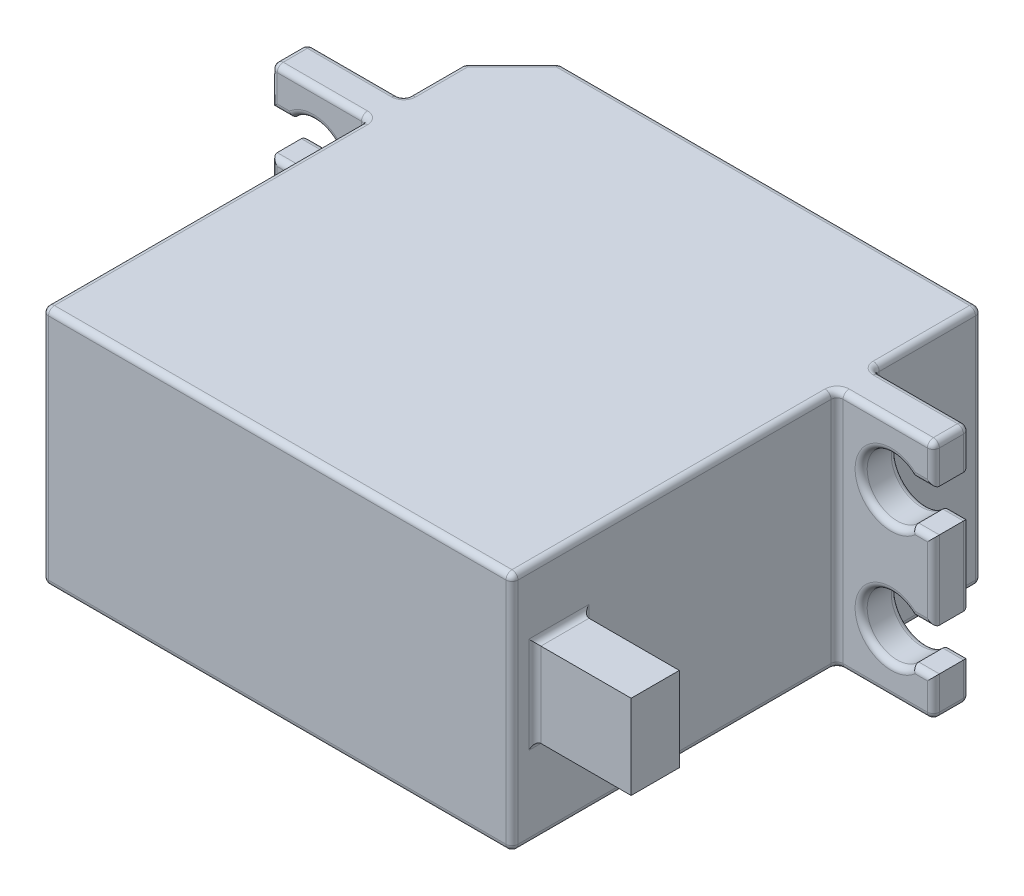
from build123d import *

# Parameters (mm, degrees)
BOSS_EXTRU_1_DEPTH      = 20
BOSS_EXTRU_2_DEPTH      = 8
BOSS_EXTRU_2_DEPTH_BACK = 47
ESQUISSE2_W             = 3
ESQUISSE2_H             = 20
ENL_V_MAT_EXTRU_1_DEPTH = 8
ENL_V_MAT_EXTRU_2_DEPTH = 8
ESQUISSE6_R             = 6
BOSS_EXTRU_3_DEPTH      = 1
ESQUISSE7_R             = 3
BOSS_EXTRU_4_DEPTH      = 4
ESQUISSE8_W             = 4
ESQUISSE8_H             = 7
BOSS_EXTRU_5_DEPTH      = 8
CONG_1_R                = 0.5


with BuildPart() as part:
    # Esquisse1 → Boss.-Extru.1 (new body)
    with BuildSketch(Plane(origin=(0, 0, 0), x_dir=(1, 0, 0), z_dir=(0, 1, 0))):
        Polygon((0, 35), (4, 39), (39, 39), (39, 0), (0, 0), align=None)
    extrude(amount=BOSS_EXTRU_1_DEPTH)

    # Esquisse2 → Boss.-Extru.2 (add, two sides: drawn at the far end of the back side and taken through both)
    with BuildSketch(Plane.ZY.offset(-BOSS_EXTRU_2_DEPTH_BACK)):
        with Locations((-28.5, 10)):
            Rectangle(ESQUISSE2_W, ESQUISSE2_H)
    extrude(amount=BOSS_EXTRU_2_DEPTH + BOSS_EXTRU_2_DEPTH_BACK)

    # Esquisse3 → Enlèv. mat.-Extru.1 (cut)
    with BuildSketch(Plane(origin=(0, 0, -30), x_dir=(-1, 0, 0), z_dir=(0, 0, -1))):
        with BuildLine():
            Line((6.285357107, 3.25), (8, 3.25))
            Line((8, 3.25), (8, 6.75))
            Line((8, 6.75), (6.285357107, 6.75))
            ThreePointArc((6.285357107, 6.75), (2, 5), (6.285357107, 3.25))
        make_face()
        with BuildLine():
            Line((6.285357107, 13.25), (8, 13.25))
            Line((8, 13.25), (8, 16.75))
            Line((8, 16.75), (6.285357107, 16.75))
            ThreePointArc((6.285357107, 16.75), (2, 15), (6.285357107, 13.25))
        make_face()
    extrude(amount=-ENL_V_MAT_EXTRU_1_DEPTH, mode=Mode.SUBTRACT)

    # Esquisse4 → Enlèv. mat.-Extru.2 (cut)
    with BuildSketch(Plane(origin=(0, 0, -30), x_dir=(-1, 0, 0), z_dir=(0, 0, -1))):
        with BuildLine():
            Line((-47, 3.25), (-45.285357107, 3.25))
            ThreePointArc((-45.285357107, 3.25), (-41, 5), (-45.285357107, 6.75))
            Line((-45.285357107, 6.75), (-47, 6.75))
            Line((-47, 6.75), (-47, 3.25))
        make_face()
        with BuildLine():
            Line((-45.285357107, 13.25), (-47, 13.25))
            Line((-47, 13.25), (-47, 16.75))
            Line((-47, 16.75), (-45.285357107, 16.75))
            ThreePointArc((-45.285357107, 16.75), (-41, 15), (-45.285357107, 13.25))
        make_face()
    extrude(amount=-ENL_V_MAT_EXTRU_2_DEPTH, mode=Mode.SUBTRACT)

    # Esquisse6 → Boss.-Extru.3 (add)
    with BuildSketch(Plane(origin=(0, 0, -39), x_dir=(-1, 0, 0), z_dir=(0, 0, -1))):
        with Locations(Location((-29, 10, 0), (0, 0, 180))):
            Circle(ESQUISSE6_R)
    extrude(amount=BOSS_EXTRU_3_DEPTH)

    # Esquisse7 → Boss.-Extru.4 (add)
    with BuildSketch(Plane(origin=(0, 0, -40), x_dir=(-1, 0, 0), z_dir=(0, 0, -1))):
        with Locations((-29, 10)):
            Circle(ESQUISSE7_R)
    extrude(amount=BOSS_EXTRU_4_DEPTH)

    # Esquisse8 → Boss.-Extru.5 (add)
    with BuildSketch(Plane(origin=(39, 0, 0), x_dir=(0, 0, -1), z_dir=(1, 0, 0))):
        with Locations((3.89656498, 10.803397143)):
            Rectangle(ESQUISSE8_W, ESQUISSE8_H)
    extrude(amount=BOSS_EXTRU_5_DEPTH)

    # Congé1
    cong_1_edges = [part.edges().sort_by_distance(p)[0] for p in [
        (39, 20, -13.5),
        (46.142678554, 6.75, -27),
        (41, 5, -27),
        (46.142678554, 3.25, -27),
        (46.142678554, 3.25, -30),
        (41, 5, -30),
        (46.142678554, 6.75, -30),
        (23, 10, -39),
        (23, 10, -40),
        (39, 10.803397143, -5.89656498),
        (39, 14.303397143, -3.89656498),
        (39, 10.803397143, -1.89656498),
        (39, 7.303397143, -3.89656498),
        (21.5, 20, -39),
        (2, 20, -37),
        (0, 0, -13.5),
        (39, 0, -34.5),
        (0, 20, -13.5),
        (39, 20, -34.5),
        (-4, 20, -30),
        (47, 20, -28.5),
        (43, 20, -30),
        (-4, 0, -27),
        (47, 0, -28.5),
        (43, 0, -27),
        (-4, 0, -30),
        (47, 18.375, -30),
        (43, 0, -30),
        (-4, 20, -27),
        (47, 1.625, -27),
        (43, 20, -27),
        (0, 10, -30),
        (39, 10, -30),
        (0, 10, -27),
        (39, 10, -27),
        (-8, 18.375, -30),
        (-8, 0, -28.5),
        (-8, 1.625, -27),
        (-8, 20, -28.5),
        (0, 20, -32.5),
        (-8, 10, -30),
        (-8, 18.375, -27),
        (-2, 15, -27),
        (-7.142678554, 16.75, -27),
        (-7.142678554, 13.25, -27),
        (-2, 15, -30),
        (-7.142678554, 13.25, -30),
        (-7.142678554, 16.75, -30),
        (2, 0, -37),
        (21.5, 0, -39),
        (-8, 10, -27),
        (-8, 1.625, -30),
        (39, 0, -13.5),
        (-2, 5, -27),
        (-7.142678554, 6.75, -27),
        (19.5, 0, 0),
        (-7.142678554, 3.25, -27),
        (-2, 5, -30),
        (-7.142678554, 3.25, -30),
        (-7.142678554, 6.75, -30),
        (0, 0, -32.5),
        (19.5, 20, 0),
        (47, 10, -30),
        (47, 18.375, -27),
        (41, 15, -27),
        (46.142678554, 13.25, -27),
        (46.142678554, 16.75, -27),
        (41, 15, -30),
        (46.142678554, 16.75, -30),
        (46.142678554, 13.25, -30),
        (0, 10, -35),
        (4, 10, -39),
        (39, 10, -39),
        (39, 10, 0),
        (0, 10, 0),
        (47, 1.625, -30),
        (47, 10, -27),
    ]]
    fillet(cong_1_edges, radius=CONG_1_R - 0.0001)  # a hair under: the kernel refuses the full size


solid = part.part
